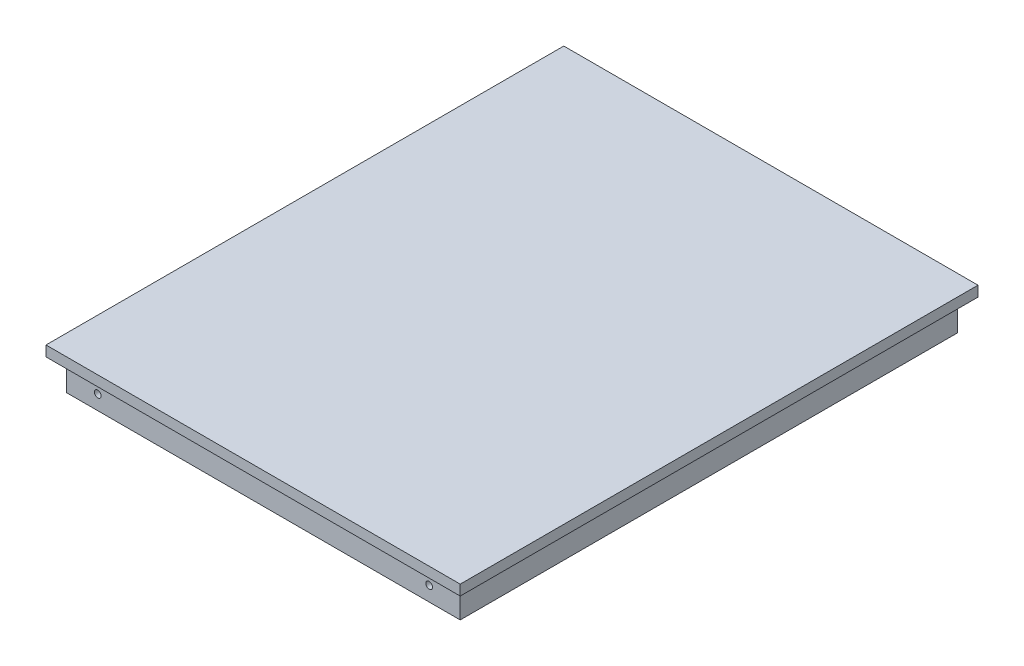
from build123d import *

# Parameters (mm, degrees)
SKETCH1_W           = 200
SKETCH1_H           = 250
BOSS_EXTRUDE1_DEPTH = 5
SKETCH1_3_W         = 190
SKETCH1_3_H         = 240
SKETCH1_3_W_2       = 180
SKETCH1_3_H_2       = 230
BOSS_EXTRUDE2_DEPTH = 15
SKETCH2_R           = 1.625
CUT_EXTRUDE1_DEPTH  = 161.779351908


with BuildPart() as part:
    # Sketch1 → Boss-Extrude1 (new body)
    with BuildSketch(Plane(origin=(0, 0, 0), x_dir=(1, 0, 0), z_dir=(0, 1, 0))):
        Rectangle(SKETCH1_W, SKETCH1_H)
    extrude(amount=BOSS_EXTRUDE1_DEPTH)

    # Sketch1<3> → Boss-Extrude2 (add)
    with BuildSketch(Plane(origin=(0, 0, 0), x_dir=(1, 0, 0), z_dir=(0, 1, 0))):
        Rectangle(SKETCH1_3_W, SKETCH1_3_H)
        Rectangle(SKETCH1_3_W_2, SKETCH1_3_H_2, mode=Mode.SUBTRACT)
    extrude(amount=-BOSS_EXTRUDE2_DEPTH)

    # Sketch2 → Cut-Extrude1 (cut, symmetric)
    with BuildSketch(Plane.XY):
        with Locations((-80, -8)):
            Circle(SKETCH2_R)
    cut_extrude1 = extrude(amount=CUT_EXTRUDE1_DEPTH, both=True, mode=Mode.SUBTRACT)

    # Mirror1: Cut-Extrude1 across plane
    add(cut_extrude1.mirror(Plane(origin=(0, 0, 0), x_dir=(0, 0, 1), z_dir=(1, 0, 0))), mode=Mode.SUBTRACT)


solid = part.part
